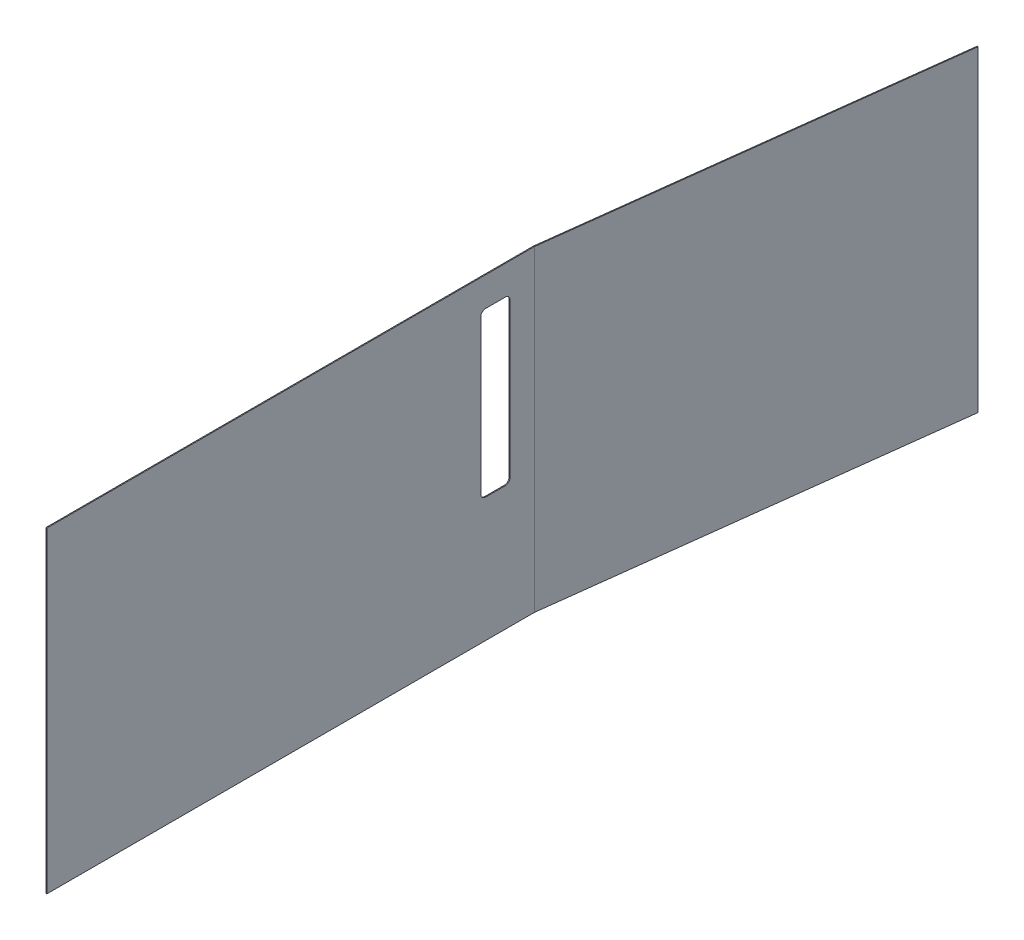
from build123d import *

# Parameters (mm, degrees)
BRIDA_BASE2_DEPTH          = 650
CORTAR_EXTRUIR1_DEPTH      = 1198.031165008
CORTAR_EXTRUIR1_DEPTH_BACK = 1198.031165008


# Sheet-metal steps are written as plain solids
with BuildPart() as part:
    # Croquis1 → Brida base2 (new body)
    with BuildSketch(Plane(origin=(0, 0, 0), x_dir=(1, 0, 0), z_dir=(0, 1, 0))):
        with BuildLine():
            Line((0, -1000), (0, -0.045297188))
            ThreePointArc((0, -0.045297188), (0.001388837, -8.5406e-05), (0.005550109, 0.044955885))
            Line((0.005550109, 0.044955885), (100, 810))
            Line((100, 810), (98.114316057, 810.232800487))
            Line((98.114316057, 810.232800487), (-1.880133834, 0.277756371))
            ThreePointArc((-1.880133834, 0.277756371), (-1.895028772, 0.116534721), (-1.9, -0.045297188))
            Line((-1.9, -0.045297188), (-1.9, -1000))
            Line((-1.9, -1000), (0, -1000))
        make_face()
    extrude(amount=BRIDA_BASE2_DEPTH)

    # Croquis11 → Cortar-Extruir1 (cut, two sides: drawn at the far end of the back side and taken through both)
    with BuildSketch(Plane.ZY.offset(1.9).offset(-CORTAR_EXTRUIR1_DEPTH_BACK)):
        with BuildLine():
            Line((60, 590), (100, 590))
            ThreePointArc((100, 590), (107.071067812, 587.071067812), (110, 580))
            Line((110, 580), (110, 265))
            ThreePointArc((110, 265), (107.071067812, 257.928932188), (100, 255))
            Line((100, 255), (60, 255))
            ThreePointArc((60, 255), (52.928932188, 257.928932188), (50, 265))
            Line((50, 265), (50, 580))
            ThreePointArc((50, 580), (52.928932188, 587.071067812), (60, 590))
        make_face()
    extrude(amount=CORTAR_EXTRUIR1_DEPTH + CORTAR_EXTRUIR1_DEPTH_BACK, mode=Mode.SUBTRACT)


solid = part.part
